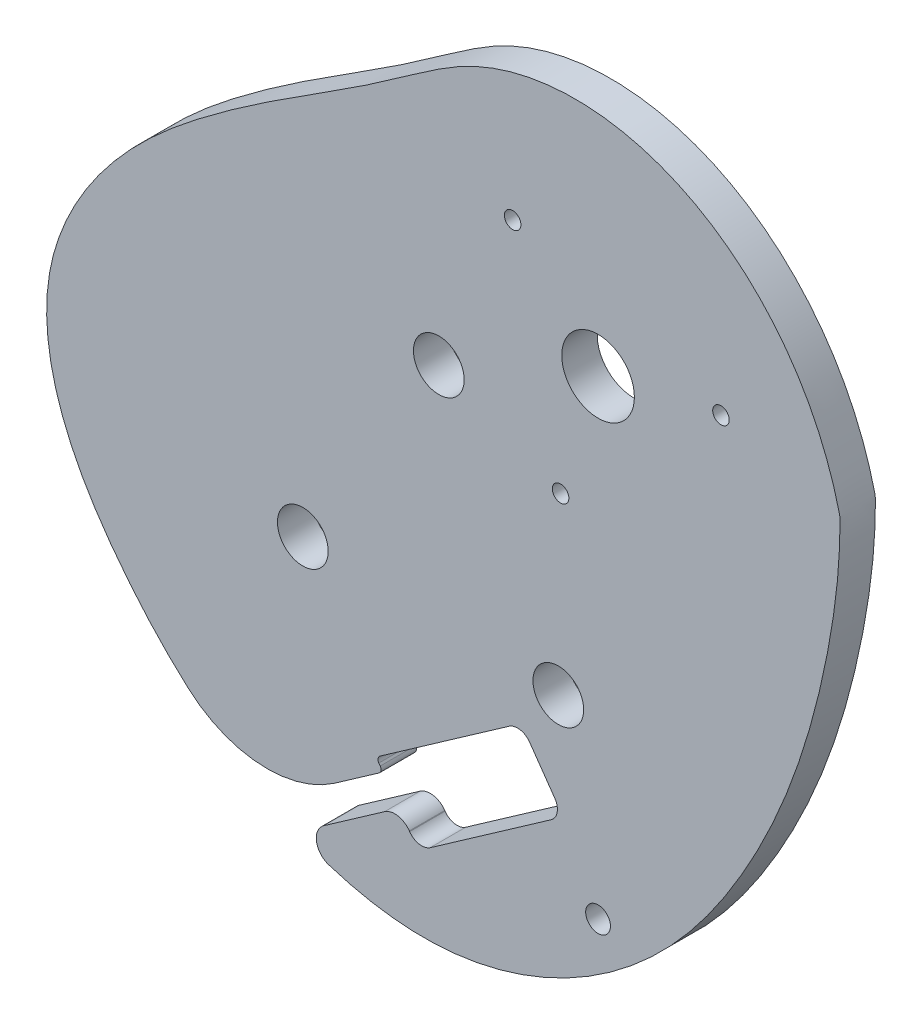
from build123d import *

# Parameters (mm, degrees)
SKETCH1_R               = 3.075
BOSS_EXTRUDE1_DEPTH     = 1.5
M4_CLEARANCE_HOLE1_D    = 4.3
CUT_EXTRUDE1_DEPTH      = 68.431915092
CUT_EXTRUDE1_DEPTH_BACK = 68.431915092
FILLET1_R               = 10
M2X0_4_TAPPED_HOLE1_D   = 1.4
FILLET2_R               = 1.5
SKETCH14_R              = 1.05
CUT_EXTRUDE2_DEPTH      = 68.431915092
FILLET3_R               = 0.4
FILLET4_R               = 1.25


with BuildPart() as part:
    # Sketch1 → Boss-Extrude1 (new, symmetric)
    with BuildSketch(Plane.XY):
        with BuildLine():
            add(Edge.make_bspline(
                [(20.469276515, 0), (20.453926982, 0.12032637), (20.37906939, 0.354674879), (20.296830063, 0.708499092), (20.201433403, 1.058274137), (20.104513169, 1.405451482), (20.003039964, 1.749648928), (19.897882185, 2.090972241), (19.788868962, 2.429397518), (19.676103633, 2.764935406), (19.559614296, 3.097587319), (19.439446847, 3.427357), (19.315640263, 3.754247363), (19.18823323, 4.078261244), (19.057262426, 4.399401123), (18.922763033, 4.717669117), (18.784768655, 5.033066908), (18.643311395, 5.345595684), (18.498421896, 5.655256084), (18.350129388, 5.962048143), (18.198461741, 6.265971239), (18.043445514, 6.567024042), (17.885106009, 6.865204466), (17.723467325, 7.160509621), (17.558552411, 7.452935769), (17.390383125, 7.742478283), (17.218980293, 8.029131604), (17.044363762, 8.312889204), (16.866552466, 8.593743551), (16.685564483, 8.871686073), (16.501417094, 9.146707128), (16.314126853, 9.418795975), (16.123709641, 9.687940747), (15.930180735, 9.954128423), (15.73355487, 10.21734481), (15.533846304, 10.477574522), (15.331068884, 10.734800958), (15.125236108, 10.989006292), (14.916361195, 11.240171456), (14.704457148, 11.48827613), (14.48953682, 11.733298735), (14.271612982, 11.975216425), (14.050698387, 12.214005082), (13.826805837, 12.449639318), (13.599948249, 12.682092471), (13.37013872, 12.911336613), (13.137390595, 13.137342549), (12.901717528, 13.360079832), (12.66313355, 13.579516764), (12.42165313, 13.795620417), (12.177291245, 14.00835664), (11.930063436, 14.21769008), (11.679985874, 14.423584196), (11.427075422, 14.626001285), (11.171349697, 14.824902501), (10.912827125, 15.020247881), (10.651527006, 15.211996372), (10.387469571, 15.400105862), (10.120676038, 15.584533205), (9.851168668, 15.765234263), (9.578970821, 15.942163933), (9.30410701, 16.115276188), (9.026602952, 16.284524115), (8.746485624, 16.449859953), (8.463783305, 16.611235142), (8.178525632, 16.768600359), (7.890743643, 16.921905569), (7.600469825, 17.071100071), (7.307738154, 17.216132546), (7.012584144, 17.356951111), (6.71504488, 17.493503366), (6.415159063, 17.625736452), (6.112967045, 17.753597106), (5.808510864, 17.877031712), (5.501834279, 17.995986365), (5.192982801, 18.110406928), (4.882003722, 18.22023909), (4.568946147, 18.32542843), (4.253861014, 18.425920478), (3.936801123, 18.521660778), (3.617821156, 18.612594954), (3.296977698, 18.698668773), (2.974329252, 18.779828214), (2.649936258, 18.856019533), (2.323861105, 18.927189329), (1.996168144, 18.993284617), (1.666923695, 19.054252892), (1.336196056, 19.110042202), (1.004055505, 19.160601215), (0.670574308, 19.205879292), (0.335826712, 19.245826554), (-0.000111049, 19.280393959), (-0.337160764, 19.309533366), (-0.675242249, 19.33319761), (-1.014273357, 19.351340575), (-1.354169986, 19.36391726), (-1.694846096, 19.370883857), (-2.036213723, 19.372197815), (-2.378182996, 19.367817918), (-2.720662158, 19.357704349), (-3.06355759, 19.341818766), (-3.406773832, 19.320124369), (-3.750213613, 19.29258597), (-4.093777879, 19.259170061), (-4.437365826, 19.219844885), (-4.780874932, 19.174580501), (-5.124200991, 19.123348854), (-5.467238158, 19.066123837), (-5.809878982, 19.002881361), (-6.152014452, 18.933599416), (-6.493534041, 18.858258136), (-6.834325754, 18.776839862), (-7.174276174, 18.689329199), (-7.513270515, 18.595713085), (-7.851192674, 18.49598084), (-8.187925289, 18.39012423), (-8.52334979, 18.278137522), (-8.857346463, 18.160017536), (-9.18979451, 18.035763705), (-9.520572102, 17.905378106), (-9.849556485, 17.76886559), (-10.176623887, 17.626233534), (-10.501650192, 17.477492989), (-10.824508724, 17.322654615), (-11.145080224, 17.161743427), (-11.463230747, 16.994735948), (-11.779050897, 16.821987195), (-12.092717082, 16.643916451), (-12.40442328, 16.460901436), (-12.714391967, 16.273307346), (-13.022869092, 16.08147821), (-13.330124311, 15.885737879), (-13.636449754, 15.686388462), (-13.942159146, 15.48370949), (-14.247586785, 15.277956924), (-14.553086511, 15.069362251), (-14.859030639, 14.858131599), (-15.165808852, 14.64444489), (-15.473827068, 14.428455032), (-15.783506277, 14.210287148), (-16.095281345, 13.990037832), (-16.40959979, 13.767774461), (-16.72692054, 13.54353453), (-17.047712658, 13.317325034), (-17.372454053, 13.089121892), (-17.701630161, 12.858869404), (-18.035732622, 12.62647976), (-18.375257928, 12.391832591), (-18.720706063, 12.15477456), (-19.072579127, 11.915119006), (-19.43137995, 11.672645633), (-19.797610697, 11.427100253), (-20.171771452, 11.17819457), (-20.554358808, 10.925606023), (-20.94586444, 10.668977684), (-21.346773666, 10.407918194), (-21.757564012, 10.14200177), (-22.178703761, 9.870768248), (-22.6106505, 9.593723189), (-23.053849668, 9.310338029), (-23.508733094, 9.020050289), (-23.975717536, 8.722263829), (-24.455203223, 8.416349151), (-24.947572399, 8.101643764), (-25.453187868, 7.777452583), (-25.972391547, 7.443048392), (-26.505503025, 7.097672347), (-27.052818136, 6.74053453), (-27.614607536, 6.370814557), (-28.191115299, 5.98766223), (-28.782557525, 5.590198235), (-29.389120965, 5.1775149), (-30.01096166, 4.74867698), (-30.64820362, 4.302722541), (-31.300937436, 3.838663708), (-31.969219271, 3.355488182), (-32.653068482, 2.852157975), (-33.352355561, 2.327705554), (-34.066325533, 1.781561053), (-34.792156176, 1.21198818), (-35.526433511, 0.617909195), (-36.265587734, -0.001457622), (-37.006020345, -0.646671842), (-37.744112291, -1.318073183), (-38.476233993, -2.015780313), (-39.198754785, -2.739691012), (-39.908052424, -3.489482365), (-40.600522516, -4.264611377), (-41.272587879, -5.064315898), (-41.920707839, -5.8876159), (-42.541387444, -6.733315094), (-43.131186577, -7.600002901), (-43.686728957, -8.486056757), (-44.204711001, -9.389644786), (-44.681910487, -10.308728765), (-45.115195144, -11.241067557), (-45.501530481, -12.184220343), (-45.837989248, -13.135551967), (-46.121753439, -14.092231719), (-46.350171981, -15.051382919), (-46.520731563, -16.010470183), (-46.635259313, -16.966833368), (-46.695881182, -17.918707922), (-46.704758414, -18.864589252), (-46.664077675, -19.803116927), (-46.576039325, -20.733069832), (-46.442852564, -21.653366621), (-46.266728948, -22.563064411), (-46.04987654, -23.461357639), (-45.794494099, -24.347576614), (-45.502765451, -25.221185937), (-45.176853985, -26.081782762), (-44.818897277, -26.929094921), (-44.431001821, -27.762978927), (-44.015237852, -28.583417844), (-43.57363427, -29.390519034), (-43.108173634, -30.184511764), (-42.620787267, -30.965744674), (-42.113350378, -31.734683158), (-41.587677508, -32.491906358), (-41.045517213, -33.238104962), (-40.488554103, -33.974069902), (-39.918413965, -34.700676565), (-39.33481729, -35.417341816), (-38.737534614, -36.123431266), (-38.126368953, -36.818284488), (-37.501156774, -37.501216811), (-36.861768424, -38.171521432), (-36.208109378, -38.828470556), (-35.54012122, -39.471316853), (-34.857782619, -40.099294871), (-34.161110261, -40.711622507), (-33.450159719, -41.307502509), (-32.725026287, -41.886124006), (-31.985845748, -42.446664075), (-31.232795105, -42.98828933), (-30.466093242, -43.510157547), (-29.686001549, -44.011419305), (-28.892824481, -44.491219662), (-28.08691006, -44.948699845), (-27.268650333, -45.382998964), (-26.438481761, -45.793255749), (-25.596885557, -46.178610297), (-24.744387965, -46.538205845), (-23.881560483, -46.871190547), (-23.009020024, -47.176719273), (-22.127429019, -47.45395541), (-21.237495463, -47.702072683), (-20.339972901, -47.920256977), (-19.435660354, -48.10770816), (-18.525402181, -48.263641942), (-17.610087896, -48.387291641), (-16.690651874, -48.477910274), (-15.768073177, -48.534771472), (-14.84337466, -48.55717479), (-13.917624463, -48.544434556), (-12.991941631, -48.495930985), (-12.067628664, -48.41094298), (-11.146068248, -48.290046351), (-10.228680944, -48.134143741), (-9.316882792, -47.944122816), (-8.412028473, -47.72093942), (-7.515412754, -47.465590968), (-6.62826823, -47.179120315), (-5.751764231, -46.862611411), (-4.88700552, -46.517187103), (-4.03503117, -46.144006323), (-3.196813506, -45.744261393), (-2.373257143, -45.319175263), (-1.565198119, -44.86999873), (-0.773403127, -44.398007635), (0.001431168, -43.904500034), (0.758678706, -43.390793354), (1.497784521, -42.858221534), (2.218265124, -42.308132156), (2.919708798, -41.74188356), (3.601775788, -41.160841961), (4.2641984, -40.566378558), (4.906780999, -39.959866645), (5.529399907, -39.342678725), (6.132003211, -38.716183626), (6.714610467, -38.081743631), (7.277312313, -37.440711615), (7.82026998, -36.794428197), (8.343714715, -36.144218914), (8.847947092, -35.491391398), (9.333336294, -34.837232621), (9.800319062, -34.183006019), (10.24939942, -33.529949158), (10.681145161, -32.879269558), (11.096195715, -32.232147378), (11.49523197, -31.589707036), (11.879149859, -30.952992781), (12.248517048, -30.322552069), (12.603694342, -29.698556098), (12.945153788, -29.0811272), (13.273344314, -28.470359529), (13.588713491, -27.866335339), (13.891701075, -27.269121707), (14.182740239, -26.678771864), (14.462256803, -26.095325337), (14.730669009, -25.518808409), (14.988387177, -24.949234509), (15.2358134, -24.386604625), (15.473341258, -23.830907716), (15.701355534, -23.282121139), (15.920231962, -22.740211075), (16.130336972, -22.205132959), (16.332027463, -21.676831916), (16.525650586, -21.155243203), (16.711543541, -20.640292652), (16.890033391, -20.131897115), (17.061436892, -19.629964916), (17.226060335, -19.134396296), (17.384199405, -18.645083873), (17.536139055, -18.161913089), (17.682153396, -17.684762669), (17.822505599, -17.213505075), (17.957447815, -16.748006957), (18.087221108, -16.288129613), (18.212055405, -15.833729436), (18.332169455, -15.384658369), (18.447770812, -14.940764355), (18.559055824, -14.501891782), (18.666209639, -14.067881928), (18.769406229, -13.638573405), (18.868808423, -13.213802595), (18.964567955, -12.793404083), (19.056825528, -12.37721109), (19.14571089, -11.965055896), (19.231342923, -11.556770257), (19.313829749, -11.152185827), (19.393268841, -10.751134561), (19.469747157, -10.353449118), (19.543341277, -9.95896326), (19.614117561, -9.567512236), (19.682132311, -9.178933172), (19.747431952, -8.793065437), (19.810053221, -8.409751015), (19.870023364, -8.028834861), (19.927360353, -7.650165254), (19.982073105, -7.273594135), (20.034161718, -6.898977439), (20.083617711, -6.526175422), (20.130424277, -6.15505297), (20.174556549, -5.785479904), (20.215981868, -5.417331275), (20.254660065, -5.050487643), (20.290543747, -4.684835353), (20.323578606, -4.320266795), (20.353703685, -3.956680655), (20.380851823, -3.593982143), (20.404949486, -3.232083278), (20.425918912, -2.87090287), (20.443671673, -2.510367615), (20.458134208, -2.150408957), (20.469154396, -1.790975662), (20.476850973, -1.431987855), (20.480314085, -1.073508931), (20.482447125, -0.715105964), (20.47192834, -0.358233383), (20.484273463, -0.11756243), (20.469276515, 0)],
                knots=[0, 0, 0, 0, 0.001764203, 0.003519492, 0.005266096, 0.007004244, 0.008734164, 0.010456082, 0.01217022, 0.013876802, 0.015576046, 0.017268173, 0.018953398, 0.020631935, 0.022303998, 0.023969797, 0.025629542, 0.027283438, 0.02893169, 0.030574501, 0.032212071, 0.033844598, 0.035472279, 0.037095307, 0.038713875, 0.04032817, 0.041938381, 0.043544692, 0.045147285, 0.046746342, 0.048342038, 0.04993455, 0.05152405, 0.053110709, 0.054694695, 0.056276173, 0.057855307, 0.059432256, 0.061007179, 0.062580232, 0.064151567, 0.065721335, 0.067289683, 0.068856757, 0.070422701, 0.071987653, 0.073551752, 0.075115133, 0.076677929, 0.078240269, 0.079802281, 0.08136409, 0.082925818, 0.084487586, 0.08604951, 0.087611705, 0.089174283, 0.090737355, 0.092301027, 0.093865405, 0.09543059, 0.096996683, 0.09856378, 0.100131977, 0.101701366, 0.103272038, 0.10484408, 0.106417578, 0.107992614, 0.109569269, 0.111147622, 0.112727748, 0.114309722, 0.115893614, 0.117479494, 0.11906743, 0.120657485, 0.122249722, 0.123844203, 0.125440984, 0.127040123, 0.128641672, 0.130245685, 0.13185221, 0.133461296, 0.135072989, 0.136687331, 0.138304365, 0.139924131, 0.141546665, 0.143172005, 0.144800184, 0.146431233, 0.148065183, 0.149702063, 0.151341898, 0.152984714, 0.154630532, 0.156279374, 0.157931258, 0.159586203, 0.161244224, 0.162905335, 0.164569548, 0.166236874, 0.167907321, 0.169580897, 0.171257607, 0.172937454, 0.174620442, 0.176306572, 0.177995841, 0.179688248, 0.181383788, 0.183082456, 0.184784246, 0.186489147, 0.188197151, 0.189908245, 0.191622417, 0.193339652, 0.195059933, 0.196783244, 0.198509566, 0.200238878, 0.201971181, 0.203706635, 0.205445504, 0.2071881, 0.208934793, 0.210686019, 0.212442285, 0.214204179, 0.215972379, 0.217747655, 0.219530879, 0.221323028, 0.223125194, 0.224938584, 0.226764524, 0.228604465, 0.230459983, 0.232332781, 0.234224685, 0.236137652, 0.238073757, 0.2400352, 0.242024293, 0.244043462, 0.246095238, 0.248182252, 0.250307226, 0.252472967, 0.254682362, 0.256938364, 0.259243991, 0.261602312, 0.264016447, 0.266489554, 0.269024826, 0.271625481, 0.274294763, 0.277035933, 0.279852264, 0.282747038, 0.285723547, 0.288785083, 0.291934943, 0.295176421, 0.298512813, 0.30194741, 0.305483503, 0.309124377, 0.312873317, 0.316733603, 0.320708513, 0.324801324, 0.329015309, 0.333351662, 0.33780314, 0.342360129, 0.347012767, 0.351751024, 0.35656476, 0.361443788, 0.366377916, 0.371356998, 0.376370977, 0.381409928, 0.386464106, 0.391523993, 0.396580347, 0.401624264, 0.406647238, 0.411641236, 0.416598779, 0.421513038, 0.426377942, 0.431188305, 0.435939966, 0.440631828, 0.445270717, 0.449864684, 0.454421044, 0.458946377, 0.463446541, 0.467926691, 0.472391308, 0.476844238, 0.481288728, 0.48572748, 0.490162693, 0.494596121, 0.499029126, 0.50346273, 0.507897674, 0.512334472, 0.516773466, 0.521214882, 0.525658883, 0.530105625, 0.534555313, 0.539008153, 0.543464074, 0.5479229, 0.552384417, 0.556848379, 0.561314515, 0.565782528, 0.570252105, 0.57472292, 0.579194639, 0.583666924, 0.588139439, 0.592611855, 0.597083853, 0.601555132, 0.606025412, 0.610494439, 0.614961992, 0.619427887, 0.623891985, 0.628354194, 0.632814475, 0.637272853, 0.641729416, 0.646184326, 0.650637823, 0.655090233, 0.659541971, 0.663993554, 0.668445597, 0.672898832, 0.677354104, 0.681812384, 0.68627477, 0.690742499, 0.695216754, 0.699697325, 0.704183213, 0.708673274, 0.713166232, 0.71766069, 0.722155137, 0.726647962, 0.731137456, 0.735621826, 0.7400992, 0.744567632, 0.749025113, 0.753469575, 0.757898896, 0.762310907, 0.766703399, 0.771074124, 0.775420805, 0.779741136, 0.784032793, 0.788293433, 0.792520702, 0.796712241, 0.800865688, 0.804978687, 0.809048891, 0.813073968, 0.817051612, 0.820979544, 0.824855525, 0.82867736, 0.832442913, 0.836150111, 0.839796963, 0.843381676, 0.84690413, 0.850365453, 0.853766802, 0.857109335, 0.860394205, 0.863622561, 0.866795554, 0.86991433, 0.872980033, 0.875993807, 0.878956793, 0.881870128, 0.88473495, 0.887552392, 0.890323587, 0.893049665, 0.895731754, 0.898370977, 0.900968457, 0.903525314, 0.906042661, 0.908521612, 0.910963275, 0.913368751, 0.915739141, 0.918075538, 0.920379029, 0.922650695, 0.924891611, 0.927102843, 0.929285451, 0.931440483, 0.93356898, 0.935671971, 0.937750475, 0.939805498, 0.941838034, 0.943849063, 0.945839551, 0.947810449, 0.949762689, 0.95169719, 0.953614851, 0.955516554, 0.957403159, 0.959275508, 0.961134423, 0.962980703, 0.964815124, 0.966638443, 0.96845139, 0.970254675, 0.972048981, 0.973834969, 0.975613274, 0.977384508, 0.979149256, 0.980908081, 0.982661518, 0.984410078, 0.98615425, 0.987894493, 0.989631248, 0.991364926, 0.993095918, 0.994824589, 0.996551283, 0.998276321, 1, 1, 1, 1], degree=3))
        make_face()
        Circle(SKETCH1_R, mode=Mode.SUBTRACT)
    extrude(amount=BOSS_EXTRUDE1_DEPTH, both=True)

    # M4 Clearance Hole1 (through all)
    with Locations(Plane.XY.offset(1.5)):
        with Locations((-13.488047982, -5.9360377), (-3.367538379, -25.076378767), (-25.003814781, -24.270826649)):
            Hole(M4_CLEARANCE_HOLE1_D / 2)

    # Sketch8 → Cut-Extrude1 (cut, two sides: drawn at the far end of the back side and taken through both)
    with BuildSketch(Plane.XY.offset(1.5).offset(-CUT_EXTRUDE1_DEPTH_BACK)):
        Polygon((-28.446199298, -45.301892696), (-27.069615851, -47.267857602), (-16.845389985, -40.108777579), (-15.239375963, -42.402403303), (-3.361671321, -34.085544975), (-2.952095299, -33.798756757), (-6.508269204, -28.720014083), (-6.917845227, -29.006802301), (-18.795549869, -37.323660628), (-18.221973432, -38.142812672), align=None)
    extrude(amount=CUT_EXTRUDE1_DEPTH + CUT_EXTRUDE1_DEPTH_BACK, mode=Mode.SUBTRACT)

    # Fillet1
    fillet1_edges = [part.edges().sort_by_distance(p)[0] for p in [
        (-28.001446815, -44.990473655, 0.7499997),
    ]]
    fillet(fillet1_edges, radius=FILLET1_R)

    # M2x0.4 Tapped Hole1 (through all)
    with Locations(Plane(origin=(0, 0, -1.5), x_dir=(-1, 0, 0), z_dir=(0, 0, -1))):
        with Locations((7.233951111, 7.840674418), (-10.407198784, 2.344448223), (3.173247673, -10.185122641)):
            Hole(M2X0_4_TAPPED_HOLE1_D / 2)

    # Fillet2
    fillet2_edges = [part.edges().sort_by_distance(p)[0] for p in [
        (-25.541458366, -46.197830211, 0.7499997),
        (-16.845389985, -40.108777579, 0),
    ]]
    fillet(fillet2_edges, radius=FILLET2_R)

    # Sketch14 → Cut-Extrude2 (cut, through all)
    with BuildSketch(Plane.XY.offset(1.5)):
        with Locations((0, -39.8190457)):
            Circle(SKETCH14_R)
    extrude(amount=-CUT_EXTRUDE2_DEPTH, mode=Mode.SUBTRACT)

    # Fillet3
    fillet3_edges = [part.edges().sort_by_distance(p)[0] for p in [
        (-18.221973432, -38.142812672, 0),
        (-18.795549869, -37.323660628, 0),
    ]]
    fillet(fillet3_edges, radius=FILLET3_R)

    # Fillet4
    fillet4_edges = [part.edges().sort_by_distance(p)[0] for p in [
        (-2.952095299, -33.798756757, 0),
        (-6.508269204, -28.720014083, 0),
        (-15.239375963, -42.402403303, 0),
    ]]
    fillet(fillet4_edges, radius=FILLET4_R)


solid = part.part
